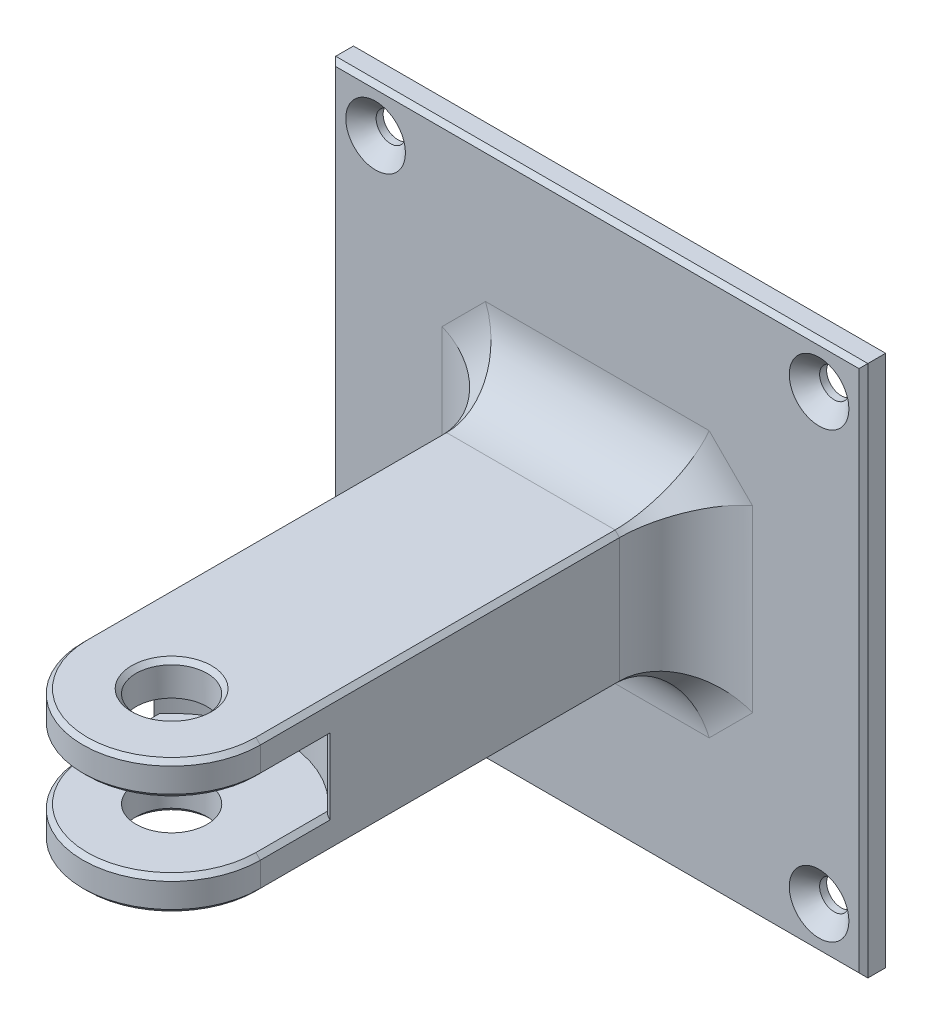
from build123d import *

# Parameters (mm, degrees)
SKETCH1_W                    = 120
SKETCH1_H                    = 120
BOSS_EXTRUDE1_DEPTH          = 5
CSK_FOR_M6_SFHCS1_AT_2_COUNT = 2
CSK_FOR_M6_SFHCS1_AT_2_PITCH = 100
CSK_FOR_M6_SFHCS1_AT_3_COUNT = 2
CSK_FOR_M6_SFHCS1_AT_3_PITCH = 141.421356237
CSK_FOR_M6_SFHCS1_AT_4_COUNT = 2
CSK_FOR_M6_SFHCS1_AT_4_PITCH = 100
SKETCH5_W                    = 96
SKETCH5_H                    = 30
BOSS_EXTRUDE2_DEPTH          = 20
SKETCH6_R                    = 20
BOSS_EXTRUDE3_DEPTH          = 15
SKETCH7_R                    = 25
CUT_EXTRUDE2_DEPTH           = 7.5
SKETCH8_R                    = 8
CUT_EXTRUDE3_DEPTH           = 155.486245342
CHAMFER1_SIZE                = 1
CHAMFER1_SIZE_2              = 0.714285714
FILLET1_R                    = 15
CHAMFER2_SIZE                = 1


with BuildPart() as part:
    # Sketch1 → Boss-Extrude1 (new body)
    with BuildSketch(Plane.XY):
        Rectangle(SKETCH1_W, SKETCH1_H)
    extrude(amount=BOSS_EXTRUDE1_DEPTH)

    # Sketch4 → CSK for M6 SFHCS1 (revolve, cut)
    with BuildSketch(Plane(origin=(-50, 50, 5), x_dir=(0, -1, 0), z_dir=(1, 0, 0))):
        Polygon((0, 0), (0, 5), (3.3, 5), (3.3, 3.42), (6.72, 0), align=None)
    csk_for_m6_sfhcs1 = revolve(axis=Axis((-50, 50, 11.35), (0, 0, -1)), mode=Mode.SUBTRACT)

    # CSK for M6 SFHCS1 at 2: CSK for M6 SFHCS1 ×2
    with Locations(*[(i * CSK_FOR_M6_SFHCS1_AT_2_PITCH, 0, 0) for i in range(1, CSK_FOR_M6_SFHCS1_AT_2_COUNT)]):
        add(csk_for_m6_sfhcs1, mode=Mode.SUBTRACT)

    # CSK for M6 SFHCS1 at 3: CSK for M6 SFHCS1 ×2
    with Locations(*[Vector(0.7071067811865476, -0.7071067811865476, 0) * (i * CSK_FOR_M6_SFHCS1_AT_3_PITCH) for i in range(1, CSK_FOR_M6_SFHCS1_AT_3_COUNT)]):
        add(csk_for_m6_sfhcs1, mode=Mode.SUBTRACT)

    # CSK for M6 SFHCS1 at 4: CSK for M6 SFHCS1 ×2
    with Locations(*[(0, -i * CSK_FOR_M6_SFHCS1_AT_4_PITCH, 0) for i in range(1, CSK_FOR_M6_SFHCS1_AT_4_COUNT)]):
        add(csk_for_m6_sfhcs1, mode=Mode.SUBTRACT)

    # Sketch5 → Boss-Extrude2 (add, symmetric)
    with BuildSketch(Plane(origin=(0, 0, 0), x_dir=(0, 0, -1), z_dir=(1, 0, 0))):
        with Locations((-53, 0)):
            Rectangle(SKETCH5_W, SKETCH5_H)
    extrude(amount=BOSS_EXTRUDE2_DEPTH, both=True)

    # Sketch6 → Boss-Extrude3 (add, symmetric)
    with BuildSketch(Plane(origin=(0, 0, 0), x_dir=(1, 0, 0), z_dir=(0, 1, 0))):
        with Locations((0, -101)):
            Circle(SKETCH6_R)
    extrude(amount=BOSS_EXTRUDE3_DEPTH, both=True)

    # Sketch7 → Cut-Extrude2 (cut, symmetric)
    with BuildSketch(Plane(origin=(0, 0, 0), x_dir=(1, 0, 0), z_dir=(0, 1, 0))):
        with Locations((0, -101)):
            Circle(SKETCH7_R)
    extrude(amount=CUT_EXTRUDE2_DEPTH, both=True, mode=Mode.SUBTRACT)

    # Sketch8 → Cut-Extrude3 (cut, through all)
    with BuildSketch(Plane(origin=(0, 15, 0), x_dir=(1, 0, 0), z_dir=(0, 1, 0))):
        with Locations(Location((0, -101, 0), (0, 0, 270))):
            Circle(SKETCH8_R)
    extrude(amount=-CUT_EXTRUDE3_DEPTH, mode=Mode.SUBTRACT)

    # Chamfer1
    # the kernel refuses this chamfer: 1, 0.714285714 mm, written as the material it takes off along each edge
    with BuildSketch(Plane(origin=(-20, 15, 5), x_dir=(0, -1, 0), z_dir=(0, 0, 1))) as chamfer1_piece_1:
        Polygon((CHAMFER1_SIZE, 0), (0, CHAMFER1_SIZE), (0, 0), align=None)
    extrude(amount=96, mode=Mode.SUBTRACT)
    with BuildSketch(Plane(origin=(-20, -15, 101), x_dir=(1, 0, 0), z_dir=(0, 0, -1)), Plane(origin=(20, 15, 5), x_dir=(0, -1, 0), z_dir=(0, 0, 1)), Plane(origin=(20, -15, 101), x_dir=(0, 1, 0), z_dir=(0, 0, -1))) as chamfer1_piece_2:
        Polygon((CHAMFER1_SIZE, 0), (0, -CHAMFER1_SIZE), (0, 0), align=None)
    extrude(amount=96, mode=Mode.SUBTRACT)
    with BuildSketch(Plane(origin=(0, -15, 101), x_dir=(-1, 0, 0), z_dir=(0, 0, -1))) as chamfer1_piece_3:
        Polygon((20 - CHAMFER1_SIZE, 0), (20, CHAMFER1_SIZE), (20, 0), align=None)
    revolve(axis=Axis((0, -15, 101), (0, 1, 0)), revolution_arc=180, mode=Mode.SUBTRACT)
    with BuildSketch(Plane(origin=(0, 15, 101), x_dir=(-1, 0, 0), z_dir=(0, 0, -1))) as chamfer1_piece_4:
        Polygon((20 - CHAMFER1_SIZE, 0), (20, -CHAMFER1_SIZE), (20, 0), align=None)
    revolve(axis=Axis((0, 15, 101), (0, 1, 0)), revolution_arc=180, mode=Mode.SUBTRACT)
    with BuildSketch(Plane(origin=(0, 7.5, 101), x_dir=(-1, 0, 0), z_dir=(0, 0, -1))) as chamfer1_piece_5:
        Polygon((20 - CHAMFER1_SIZE, 0), (20, CHAMFER1_SIZE), (20, 0), align=None)
    revolve(axis=Axis((0, 7.5, 101), (0, 1, 0)), revolution_arc=180, mode=Mode.SUBTRACT)
    with BuildSketch(Plane(origin=(0, -7.5, 101), x_dir=(-1, 0, 0), z_dir=(0, 0, -1))) as chamfer1_piece_6:
        Polygon((20, -CHAMFER1_SIZE), (20 - CHAMFER1_SIZE, 0), (20, 0), align=None)
    revolve(axis=Axis((0, -7.5, 101), (0, 1, 0)), revolution_arc=180, mode=Mode.SUBTRACT)
    with BuildSketch(Plane(origin=(-20, -7.5, 83.428317012), x_dir=(0, -1, 0), z_dir=(0, 0, 1))) as chamfer1_piece_7_section:
        Polygon((CHAMFER1_SIZE, 0), (0, CHAMFER1_SIZE), (0, 0), align=None)
    chamfer1_piece_7 = extrude(amount=17.571682988, mode=Mode.PRIVATE)
    chamfer1_piece_7 = chamfer1_piece_7 & Plane(origin=(0, -7.5, 101), x_dir=(1, 0, 0), z_dir=(0, 1, 0)) * Cylinder(25, 40, mode=Mode.PRIVATE)
    add(chamfer1_piece_7, mode=Mode.SUBTRACT)
    with BuildSketch(Plane(origin=(20, 7.5, 83.428317012), x_dir=(0, 1, 0), z_dir=(0, 0, 1))) as chamfer1_piece_8_section:
        Polygon((CHAMFER1_SIZE, 0), (0, CHAMFER1_SIZE), (0, 0), align=None)
    chamfer1_piece_8 = extrude(amount=17.571682988, mode=Mode.PRIVATE)
    chamfer1_piece_8 = chamfer1_piece_8 & Plane(origin=(0, 7.5, 101), x_dir=(1, 0, 0), z_dir=(0, 1, 0)) * Cylinder(25, 40, mode=Mode.PRIVATE)
    add(chamfer1_piece_8, mode=Mode.SUBTRACT)
    with BuildSketch(Plane(origin=(20, -7.5, 83.428317012), x_dir=(0, -1, 0), z_dir=(0, 0, 1))) as chamfer1_piece_9_section:
        Polygon((CHAMFER1_SIZE, 0), (0, -CHAMFER1_SIZE), (0, 0), align=None)
    chamfer1_piece_9 = extrude(amount=17.571682988, mode=Mode.PRIVATE)
    chamfer1_piece_9 = chamfer1_piece_9 & Plane(origin=(0, -7.5, 101), x_dir=(1, 0, 0), z_dir=(0, 1, 0)) * Cylinder(25, 40, mode=Mode.PRIVATE)
    add(chamfer1_piece_9, mode=Mode.SUBTRACT)
    with BuildSketch(Plane(origin=(-20, 7.5, 83.428317012), x_dir=(0, 1, 0), z_dir=(0, 0, 1))) as chamfer1_piece_10_section:
        Polygon((CHAMFER1_SIZE, 0), (0, -CHAMFER1_SIZE), (0, 0), align=None)
    chamfer1_piece_10 = extrude(amount=17.571682988, mode=Mode.PRIVATE)
    chamfer1_piece_10 = chamfer1_piece_10 & Plane(origin=(0, 7.5, 101), x_dir=(1, 0, 0), z_dir=(0, 1, 0)) * Cylinder(25, 40, mode=Mode.PRIVATE)
    add(chamfer1_piece_10, mode=Mode.SUBTRACT)
    with BuildSketch(Plane(origin=(0, -15, 101), x_dir=(0, 0, 1), z_dir=(-1, 0, 0))) as chamfer1_piece_11:
        Polygon((8 + CHAMFER1_SIZE, 0), (8, CHAMFER1_SIZE), (8, 0), align=None)
    revolve(axis=Axis((0, -15, 101), (0, 1, 0)), mode=Mode.SUBTRACT)
    with BuildSketch(Plane(origin=(0, 15, 101), x_dir=(0, 0, 1), z_dir=(-1, 0, 0))) as chamfer1_piece_12:
        Polygon((8 + CHAMFER1_SIZE, 0), (8, -CHAMFER1_SIZE), (8, 0), align=None)
    revolve(axis=Axis((0, 15, 101), (0, 1, 0)), mode=Mode.SUBTRACT)
    with BuildSketch(Plane(origin=(-20, -7.5, 86), x_dir=(0, 0, -1), z_dir=(0, 1, 0))) as chamfer1_piece_13:
        with BuildLine():
            Line((CHAMFER1_SIZE, 0), (0.56416807, -0.43583193))
            ThreePointArc((0.56416807, -0.43583193), (0.281621078, -0.214347187), (0, 0))
            Line((0, 0), (CHAMFER1_SIZE, 0))
        make_face()
    extrude(amount=15, mode=Mode.SUBTRACT)
    with BuildSketch(Plane(origin=(20, -7.5, 86), x_dir=(0, 0, -1), z_dir=(0, 1, 0))) as chamfer1_piece_14:
        with BuildLine():
            Line((CHAMFER1_SIZE_2, 0), (0.80417029, 0.629192029))
            ThreePointArc((0.80417029, 0.629192029), (0.416667008, 0.319390803), (0, 0))
            Line((0, 0), (CHAMFER1_SIZE_2, 0))
        make_face()
    extrude(amount=15, mode=Mode.SUBTRACT)
    with BuildSketch(Plane(origin=(-20, -7.5, 83.428317012), x_dir=(0, -1, 0), z_dir=(0, 0, 1))) as chamfer1_piece_15a_section:
        Polygon((CHAMFER1_SIZE, 0), (0, CHAMFER1_SIZE), (0, 0), align=None)
    chamfer1_piece_15a = extrude(amount=17.571682988, mode=Mode.PRIVATE)
    chamfer1_piece_15a = chamfer1_piece_15a - Plane(origin=(0, -7.5, 101), x_dir=(1, 0, 0), z_dir=(0, 1, 0)) * Cylinder(25, 40, mode=Mode.PRIVATE)
    with BuildSketch(Plane(origin=(-20, -10.071682988, 86), x_dir=(0, 0, -1), z_dir=(0, 1, 0))) as chamfer1_piece_15b_section:
        with BuildLine():
            Line((CHAMFER1_SIZE, 0), (0.56416807, -0.43583193))
            ThreePointArc((0.56416807, -0.43583193), (0.281621078, -0.214347187), (0, 0))
            Line((0, 0), (CHAMFER1_SIZE, 0))
        make_face()
    chamfer1_piece_15b = extrude(amount=17.571682988, mode=Mode.PRIVATE)
    chamfer1_piece_15b = split(chamfer1_piece_15b, bisect_by=Plane(origin=(-20, -7.5, 86), z_dir=(0, -1, 0)), keep=Keep.TOP, mode=Mode.PRIVATE)
    chamfer1_piece_15 = chamfer1_piece_15a & chamfer1_piece_15b
    add(chamfer1_piece_15, mode=Mode.SUBTRACT)
    with BuildSketch(Plane(origin=(20, -7.5, 86), x_dir=(0, 0, -1), z_dir=(0, 1, 0))) as chamfer1_piece_16a_section:
        with BuildLine():
            Line((CHAMFER1_SIZE_2, 0), (0.80417029, 0.629192029))
            ThreePointArc((0.80417029, 0.629192029), (0.416667008, 0.319390803), (0, 0))
            Line((0, 0), (CHAMFER1_SIZE_2, 0))
        make_face()
    chamfer1_piece_16a = extrude(amount=17.625714283, mode=Mode.PRIVATE)
    chamfer1_piece_16a = split(chamfer1_piece_16a, bisect_by=Plane(origin=(20, 7.5, 86), z_dir=(0, 1, 0)), keep=Keep.TOP, mode=Mode.PRIVATE)
    with BuildSketch(Plane(origin=(20, 7.5, 83.428317012), x_dir=(0, 1, 0), z_dir=(0, 0, 1))) as chamfer1_piece_16b_section:
        Polygon((CHAMFER1_SIZE, 0), (0, CHAMFER1_SIZE), (0, 0), align=None)
    chamfer1_piece_16b = extrude(amount=17.571682988, mode=Mode.PRIVATE)
    chamfer1_piece_16b = chamfer1_piece_16b - Plane(origin=(0, 7.5, 101), x_dir=(1, 0, 0), z_dir=(0, 1, 0)) * Cylinder(25, 40, mode=Mode.PRIVATE)
    chamfer1_piece_16 = chamfer1_piece_16a & chamfer1_piece_16b
    add(chamfer1_piece_16, mode=Mode.SUBTRACT)
    with BuildSketch(Plane(origin=(20, -7.5, 83.428317012), x_dir=(0, -1, 0), z_dir=(0, 0, 1))) as chamfer1_piece_17a_section:
        Polygon((CHAMFER1_SIZE, 0), (0, -CHAMFER1_SIZE), (0, 0), align=None)
    chamfer1_piece_17a = extrude(amount=17.571682988, mode=Mode.PRIVATE)
    chamfer1_piece_17a = chamfer1_piece_17a - Plane(origin=(0, -7.5, 101), x_dir=(1, 0, 0), z_dir=(0, 1, 0)) * Cylinder(25, 40, mode=Mode.PRIVATE)
    with BuildSketch(Plane(origin=(20, -10.125714283, 86), x_dir=(0, 0, -1), z_dir=(0, 1, 0))) as chamfer1_piece_17b_section:
        with BuildLine():
            Line((CHAMFER1_SIZE_2, 0), (0.80417029, 0.629192029))
            ThreePointArc((0.80417029, 0.629192029), (0.416667008, 0.319390803), (0, 0))
            Line((0, 0), (CHAMFER1_SIZE_2, 0))
        make_face()
    chamfer1_piece_17b = extrude(amount=17.625714283, mode=Mode.PRIVATE)
    chamfer1_piece_17b = split(chamfer1_piece_17b, bisect_by=Plane(origin=(20, -7.5, 86), z_dir=(0, -1, 0)), keep=Keep.TOP, mode=Mode.PRIVATE)
    chamfer1_piece_17 = chamfer1_piece_17a & chamfer1_piece_17b
    add(chamfer1_piece_17, mode=Mode.SUBTRACT)
    with BuildSketch(Plane(origin=(-20, -7.5, 86), x_dir=(0, 0, -1), z_dir=(0, 1, 0))) as chamfer1_piece_18a_section:
        with BuildLine():
            Line((CHAMFER1_SIZE, 0), (0.56416807, -0.43583193))
            ThreePointArc((0.56416807, -0.43583193), (0.281621078, -0.214347187), (0, 0))
            Line((0, 0), (CHAMFER1_SIZE, 0))
        make_face()
    chamfer1_piece_18a = extrude(amount=17.571682988, mode=Mode.PRIVATE)
    chamfer1_piece_18a = split(chamfer1_piece_18a, bisect_by=Plane(origin=(-20, 7.5, 86), z_dir=(0, 1, 0)), keep=Keep.TOP, mode=Mode.PRIVATE)
    with BuildSketch(Plane(origin=(-20, 7.5, 83.428317012), x_dir=(0, 1, 0), z_dir=(0, 0, 1))) as chamfer1_piece_18b_section:
        Polygon((CHAMFER1_SIZE, 0), (0, -CHAMFER1_SIZE), (0, 0), align=None)
    chamfer1_piece_18b = extrude(amount=17.571682988, mode=Mode.PRIVATE)
    chamfer1_piece_18b = chamfer1_piece_18b - Plane(origin=(0, 7.5, 101), x_dir=(1, 0, 0), z_dir=(0, 1, 0)) * Cylinder(25, 40, mode=Mode.PRIVATE)
    chamfer1_piece_18 = chamfer1_piece_18a & chamfer1_piece_18b
    add(chamfer1_piece_18, mode=Mode.SUBTRACT)

    # Fillet1
    fillet1_edges = [part.edges().sort_by_distance(p)[0] for p in [
        (-19.5, -14.5, 5),
        (19.5, -14.5, 5),
        (-19.5, 14.5, 5),
        (19.5, 14.5, 5),
        (20, 0, 5),
        (-20, 0, 5),
        (0, 15, 5),
        (0, -15, 5),
    ]]
    fillet(fillet1_edges, radius=FILLET1_R)

    # Chamfer2
    chamfer2_edges = [part.edges().sort_by_distance(p)[0] for p in [
        (60, 0, 5),
        (0, 60, 5),
        (-60, 0, 5),
        (0, -60, 5),
    ]]
    chamfer(chamfer2_edges, length=CHAMFER2_SIZE)


solid = part.part
